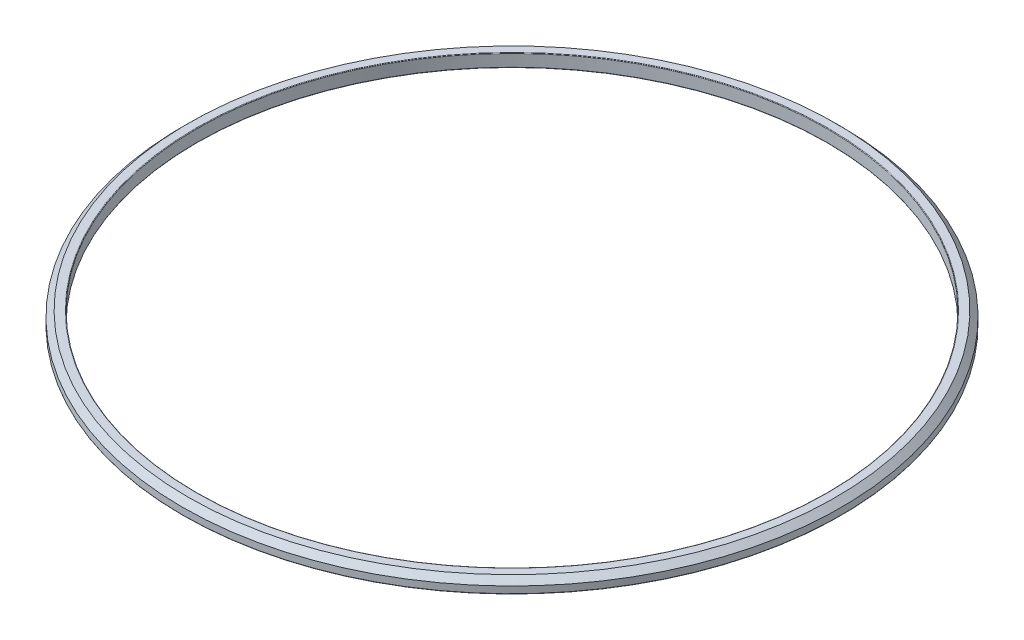
from build123d import *

# Parameters (mm, degrees)
SKETCH1_R           = 57.235
SKETCH1_R_2         = 54.765
BOSS_EXTRUDE1_DEPTH = 2.25
CHAMFER1_SIZE       = 1
FILLET1_R           = 0.1


with BuildPart() as part:
    # Sketch1 → Boss-Extrude1 (new body)
    with BuildSketch(Plane(origin=(0, 0, 0), x_dir=(1, 0, 0), z_dir=(0, 1, 0))):
        Circle(SKETCH1_R)
        Circle(SKETCH1_R_2, mode=Mode.SUBTRACT)
    extrude(amount=BOSS_EXTRUDE1_DEPTH)

    # Chamfer1
    chamfer1_edges = [part.edges().sort_by_distance(p)[0] for p in [
        (-57.235, 2.25, 0),
    ]]
    chamfer(chamfer1_edges, length=CHAMFER1_SIZE)

    # Fillet1
    fillet1_edges = [part.edges().sort_by_distance(p)[0] for p in [
        (-54.765, 2.25, 0),
        (-54.765, 0, 0),
        (-57.235, 0, 0),
    ]]
    fillet(fillet1_edges, radius=FILLET1_R)


solid = part.part
